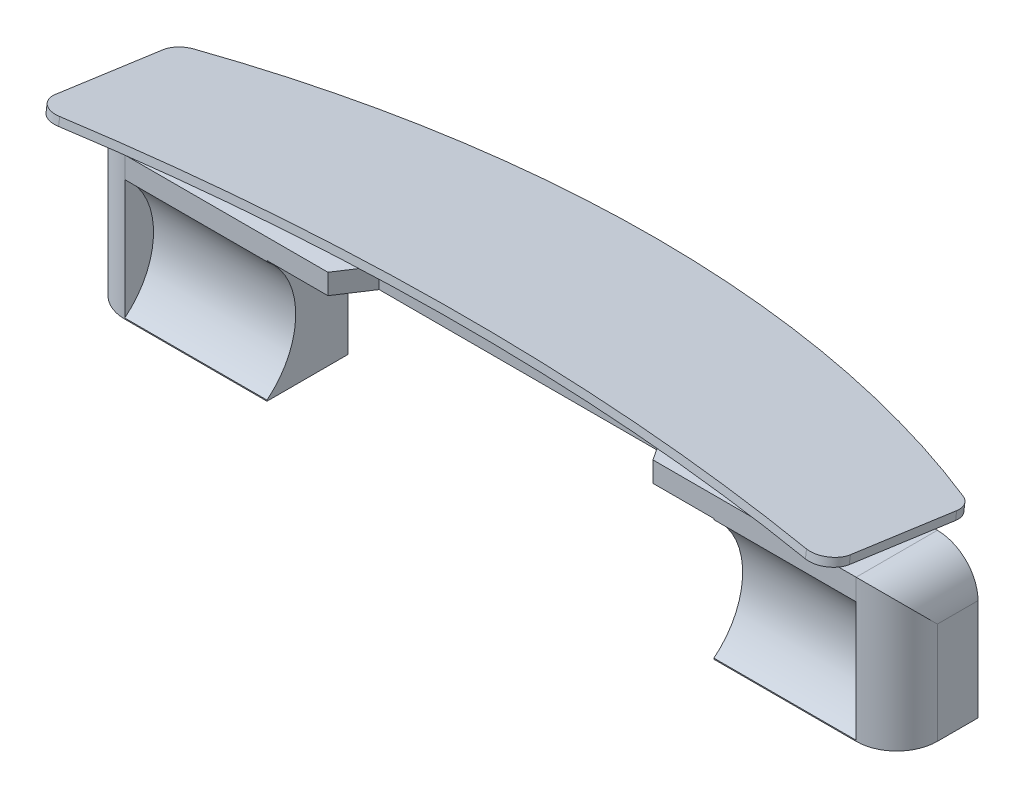
from build123d import *

# Parameters (mm, degrees)
SKETCH1_W               = 45
SKETCH1_H               = 20
BOSS_EXTRUDE1_DEPTH     = 30
BOSS_EXTRUDE1_2_DEPTH   = 30
CUT_EXTRUDE1_DEPTH      = 90
CUT_EXTRUDE1_DEPTH_BACK = 90
SKETCH2_R               = 18.91234553
SKETCH4_W               = 200
SKETCH4_H               = 20
BOSS_EXTRUDE2_DEPTH     = 5
FILLET1_R               = 10
SKETCH5_W               = 3
SKETCH5_H               = 13.263798278
BOSS_EXTRUDE3_DEPTH     = 10
CHAMFER1_SIZE           = 2.108112521
CHAMFER1_SIZE_2         = 15
BOSS_EXTRUDE4_DEPTH     = 2
FILLET2_R               = 5
CUT_EXTRUDE2_DEPTH      = 111.469562822


# Some blends are built 0.0001 mm under size
with BuildPart() as part:
    # Sketch1 → Boss-Extrude1 (new body)
    with BuildSketch(Plane(origin=(0, 0, 0), x_dir=(1, 0, 0), z_dir=(0, 1, 0))):
        with Locations((-77.5, 0)):
            Rectangle(SKETCH1_W, SKETCH1_H)
    extrude(amount=BOSS_EXTRUDE1_DEPTH)


with BuildPart() as body_2:
    # Sketch1 → Boss-Extrude1 2 (new body)
    with BuildSketch(Plane(origin=(0, 0, 0), x_dir=(1, 0, 0), z_dir=(0, 1, 0))):
        with Locations((77.5, 0)):
            Rectangle(SKETCH1_W, SKETCH1_H)
    extrude(amount=BOSS_EXTRUDE1_2_DEPTH)


with BuildPart() as cut_extrude1_tool:
    # Sketch2 → Cut-Extrude1 (new, two sides: drawn at the far end of the back side and taken through both)
    with BuildSketch(Plane(origin=(0, 0, 0), x_dir=(0, 0, -1), z_dir=(1, 0, 0)).offset(-CUT_EXTRUDE1_DEPTH_BACK)):
        with Locations((-21.83879207, 15)):
            Circle(SKETCH2_R)
    extrude(amount=CUT_EXTRUDE1_DEPTH + CUT_EXTRUDE1_DEPTH_BACK)


with BuildPart() as part_1:
    add(part.part)

    # Cut-Extrude1: cut by cut_extrude1_tool
    add(cut_extrude1_tool.part, mode=Mode.SUBTRACT)



with BuildPart() as body_2_1:
    add(body_2.part)

    # Cut-Extrude1: cut by cut_extrude1_tool
    add(cut_extrude1_tool.part, mode=Mode.SUBTRACT)


with BuildPart() as part_2:
    add(part_1.part)

    add(body_2_1.part)  # Boss-Extrude2 merges body 2
    # Sketch4 → Boss-Extrude2 (add)
    with BuildSketch(Plane(origin=(0, 30, 0), x_dir=(1, 0, 0), z_dir=(0, 1, 0))):
        Rectangle(SKETCH4_W, SKETCH4_H)
    extrude(amount=BOSS_EXTRUDE2_DEPTH)

    # Fillet1
    fillet1_edges = [part_2.edges().sort_by_distance(p)[0] for p in [
        (100, 17.5, 10),
        (-100, 35, 0),
        (100, 35, 0),
        (-100, 17.5, 10),
    ]]
    fillet(fillet1_edges, radius=FILLET1_R - 0.0001)  # a hair under: the kernel refuses the full size

    # Sketch5 → Boss-Extrude3 (add)
    with BuildSketch(Plane(origin=(0, 35, 0), x_dir=(1, 0, 0), z_dir=(0, 1, 0))):
        with Locations((-76.5, -0.54359829)):
            Rectangle(SKETCH5_W, SKETCH5_H)
        with Locations((76.5, -0.54359829)):
            Rectangle(SKETCH5_W, SKETCH5_H)
    extrude(amount=BOSS_EXTRUDE3_DEPTH)

    # Chamfer1
    # the kernel refuses this chamfer: 15, 2.108112521 mm, written as the material it takes off along each edge
    with BuildSketch(Plane(origin=(-116.985961034, 45, -6.088300849), x_dir=(0, -0.9651598825854408, -0.26166085119417143), z_dir=(1, 0, 0)), Plane(origin=(36.014038966, 45, -6.088300849), x_dir=(0, -0.9651598825854406, -0.26166085119417176), z_dir=(1, 0, 0))) as chamfer1_piece_1:
        Polygon((CHAMFER1_SIZE * 0.965159882373, -CHAMFER1_SIZE * 0.261660851137), (-CHAMFER1_SIZE_2 * 0.261660851194, -CHAMFER1_SIZE_2 * 0.965159882585), (0, 0), align=None)
    extrude(amount=80.971922068, mode=Mode.SUBTRACT)

    # Sketch6 → Boss-Extrude4 (add)
    with BuildSketch(Plane(origin=(0, 42.900189564, -6.02922845), x_dir=(1, 0, 0), z_dir=(0, 0.9902680687415693, -0.13917310096007307))):
        with BuildLine():
            Line((-98, 4.441058829), (-98, -31.70498546))
            ThreePointArc((-98, -31.70498546), (0.017055636, -22.045990643), (98, -32.045090114))
            Line((98, -32.045090114), (98, 3.690476172))
            ThreePointArc((98, 3.690476172), (0.081000585, 25.217488155), (-98, 4.441058829))
        make_face()
    extrude(amount=BOSS_EXTRUDE4_DEPTH)

    # Fillet2
    fillet2_edges = [part_2.edges().sort_by_distance(p)[0] for p in [
        (98, 43.37684262, -9.822962262),
        (-98, 43.272381704, -10.566240301),
        (-98, 48.302938775, 25.22803317),
        (98, 48.350272194, 25.564827949),
    ]]
    fillet(fillet2_edges, radius=FILLET2_R)

    # Sketch7 → Cut-Extrude2 (cut, through all)
    with BuildSketch(Plane(origin=(0, 35, 0), x_dir=(1, 0, 0), z_dir=(0, 1, 0))):
        Polygon((-40, -10), (-35, -2.397862122), (35, -2.397862122), (40, -10), align=None)
    extrude(amount=-CUT_EXTRUDE2_DEPTH, mode=Mode.SUBTRACT)


solid = part_2.part
